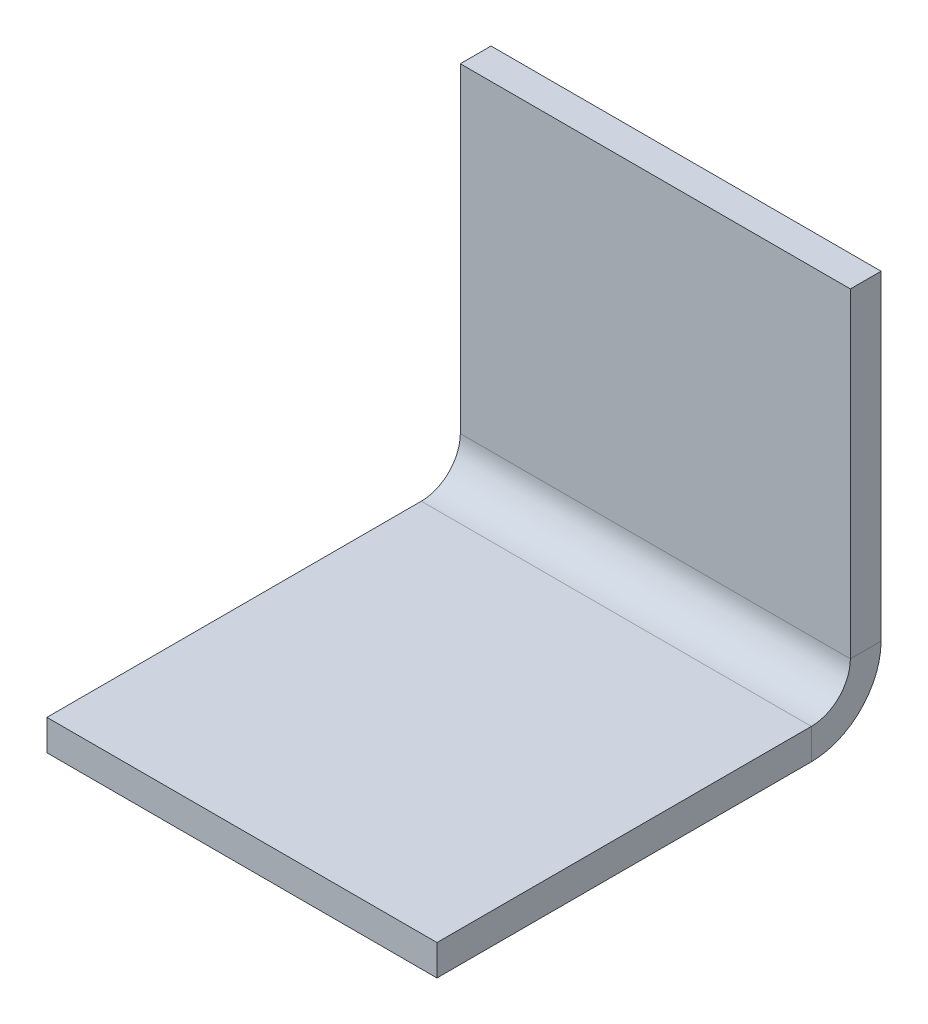
from build123d import *

# Parameters (mm, degrees)
BOSS_EXTRUDE1_DEPTH    = 2
SKETCHED_START         = -17.446464646
SKETCHED_BEND2_DEPTH   = 25.4
SKETCHED_BEND2_2_DEPTH = 25.4


# Read off the part's stored shape, not the designer's step: Sketched Bend2
with BuildPart() as part:
    # Sketch1 → Boss-Extrude1 (new body)
    with BuildSketch(Plane.XY):
        Polygon((-17.446464646, 32.712121212), (7.953535354, 32.712121212), (7.953535354, 7.825252525), (7.953535354, -18.087878788), (-17.446464646, -18.087878788), align=None)
    extrude(amount=BOSS_EXTRUDE1_DEPTH)

    # Sketched Bend2 outline → Sketched Bend2 (cut)
    with BuildSketch(Plane.YZ.offset(SKETCHED_START)):
        with BuildLine():
            ThreePointArc((11.852121212, 0), (9.721393637, 0.531059991), (8.089143668, 2))
            Line((8.089143668, 2), (-18.087878788, 2))
            Line((-18.087878788, 2), (-18.087878788, 0))
            Line((-18.087878788, 0), (11.852121212, 0))
        make_face()
    extrude(amount=SKETCHED_BEND2_DEPTH, mode=Mode.SUBTRACT)

    # Sketched Bend2 2 outline → Sketched Bend2 2 (add)
    with BuildSketch(Plane.YZ.offset(SKETCHED_START)):
        with BuildLine():
            Line((9.312121212, 4.54), (9.312121212, 28.919381003))
            Line((9.312121212, 28.919381003), (7.312121212, 28.919381003))
            Line((7.312121212, 28.919381003), (7.312121212, 4.54))
            ThreePointArc((7.312121212, 4.54), (7.510720629, 3.211903251), (8.089143668, 2))
            Line((8.089143668, 2), (11.852121212, 2))
            ThreePointArc((11.852121212, 2), (10.056069988, 2.743948776), (9.312121212, 4.54))
        make_face()
    extrude(amount=SKETCHED_BEND2_2_DEPTH)


solid = part.part
